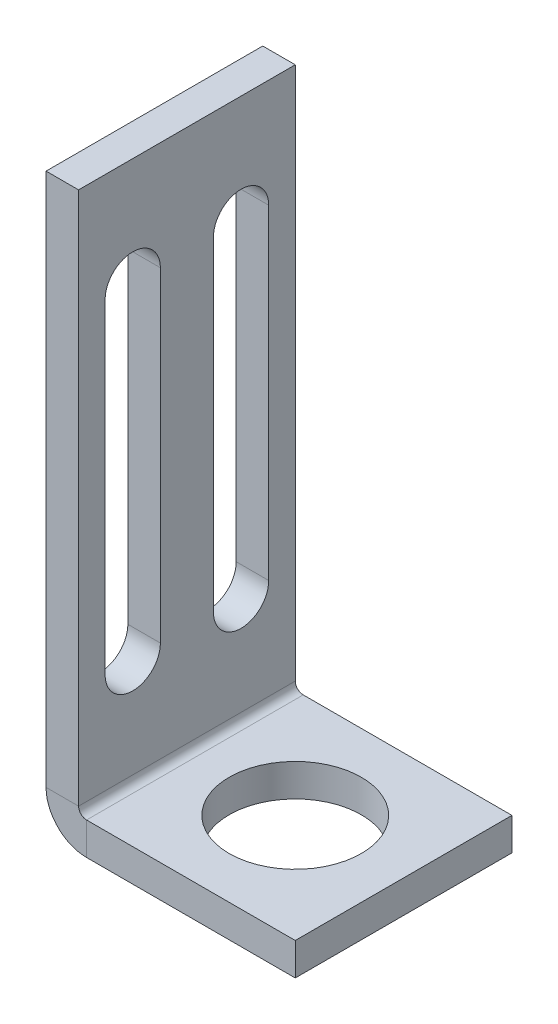
from build123d import *

# Parameters (mm, degrees)
BASE_FLANGE1_DEPTH = 20
CUT_EXTRUDE1_REACH = 59.446
SKETCH6_R          = 6.1
CUT_EXTRUDE2_REACH = 59.446


# Sheet-metal steps are written as plain solids
with BuildPart() as part:
    # Sketch1 → Base-Flange1 (new body)
    with BuildSketch(Plane.XY):
        with BuildLine():
            Line((0, 50), (0, 0.7366))
            ThreePointArc((0, 0.7366), (0.215745145, 0.215745145), (0.7366, 0))
            Line((0.7366, 0), (20, 0))
            Line((20, 0), (20, -3))
            Line((20, -3), (0.7366, -3))
            ThreePointArc((0.7366, -3), (-1.905575199, -1.905575199), (-3, 0.7366))
            Line((-3, 0.7366), (-3, 50))
            Line((-3, 50), (0, 50))
        make_face()
    extrude(amount=BASE_FLANGE1_DEPTH)

    # Sketch6 → Cut-Extrude1 (cut, up to next)
    with BuildSketch(Plane(origin=(0, 0, 0), x_dir=(1, 0, 0), z_dir=(0, 1, 0)), mode=Mode.PRIVATE) as cut_extrude1_sk1:
        with Locations(Location((10, -10, 0), (0, 0, 270))):
            Circle(SKETCH6_R)
    cut_extrude1_tool1 = extrude(cut_extrude1_sk1.sketch, amount=-CUT_EXTRUDE1_REACH, mode=Mode.PRIVATE) & part.part
    add(cut_extrude1_tool1.solids().sort_by_distance((10, 0, 10))[0], mode=Mode.SUBTRACT)

    # Sketch7 → Cut-Extrude2 (cut, up to next)
    with BuildSketch(Plane(origin=(0, 0, 0), x_dir=(0, 0, -1), z_dir=(1, 0, 0)), mode=Mode.PRIVATE) as cut_extrude2_sk1:
        with BuildLine():
            Line((-12.45, 40), (-12.45, 10))
            ThreePointArc((-12.45, 10), (-15, 7.45), (-17.55, 10))
            Line((-17.55, 10), (-17.55, 40))
            ThreePointArc((-17.55, 40), (-15, 42.55), (-12.45, 40))
        make_face()
    cut_extrude2_tool1 = extrude(cut_extrude2_sk1.sketch, amount=-CUT_EXTRUDE2_REACH, mode=Mode.PRIVATE) & part.part
    # Sketch7 → Cut-Extrude2 (cut, up to next)
    with BuildSketch(Plane(origin=(0, 0, 0), x_dir=(0, 0, -1), z_dir=(1, 0, 0)), mode=Mode.PRIVATE) as cut_extrude2_sk2:
        with BuildLine():
            Line((-2.45, 40), (-2.45, 10))
            ThreePointArc((-2.45, 10), (-5, 7.45), (-7.55, 10))
            Line((-7.55, 10), (-7.55, 40))
            ThreePointArc((-7.55, 40), (-5, 42.55), (-2.45, 40))
        make_face()
    cut_extrude2_tool2 = extrude(cut_extrude2_sk2.sketch, amount=-CUT_EXTRUDE2_REACH, mode=Mode.PRIVATE) & part.part
    add(cut_extrude2_tool1.solids().sort_by_distance((0, 25, 15))[0], mode=Mode.SUBTRACT)
    add(cut_extrude2_tool2.solids().sort_by_distance((0, 25, 5))[0], mode=Mode.SUBTRACT)


solid = part.part
